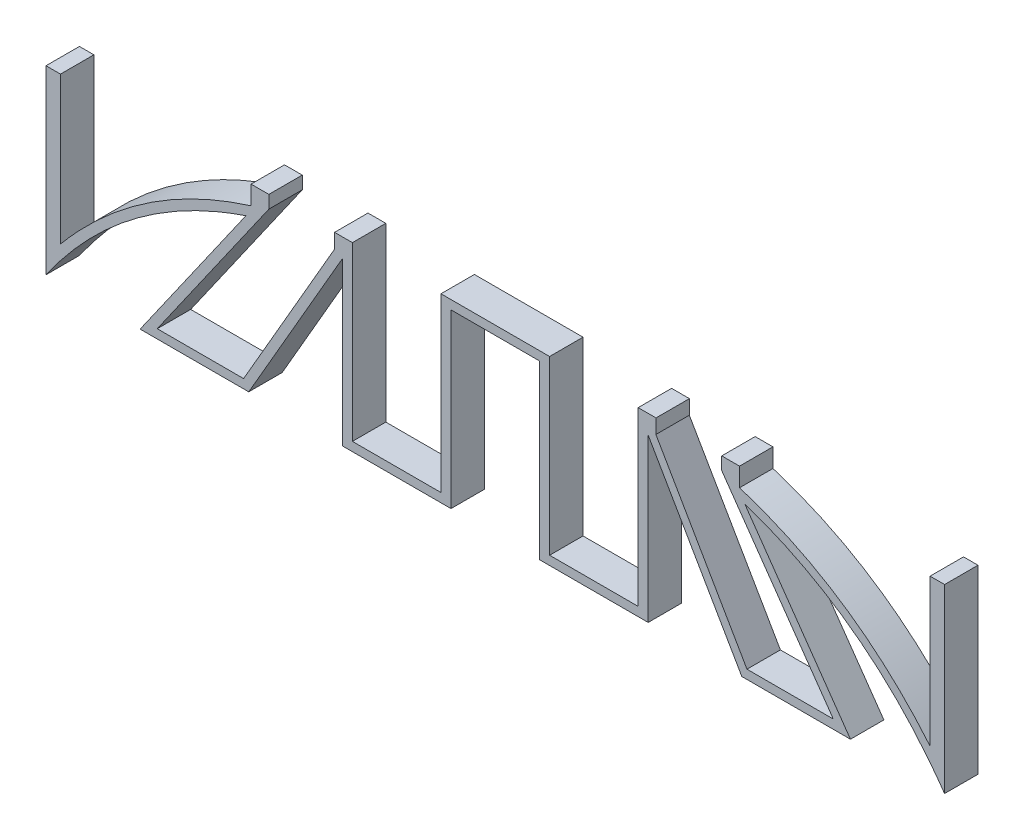
from build123d import *

# Parameters (mm, degrees)
BOSS_EXTRUDE1_DEPTH    = 3
SKETCH2_W              = 0.9
SKETCH2_H              = 15.45
BOSS_EXTRUDE2_DEPTH    = 3
SPLIT1_DEPTH           = 3
SPLIT1_START           = -36.35
SPLIT1_2_OUTLINE_W     = 16.25
SPLIT1_2_OUTLINE_H     = 3
SPLIT1_2_DEPTH         = 0.9
SPLIT1_START_2         = -35.45
SPLIT1_3_OUTLINE_W     = 0.8
SPLIT1_3_OUTLINE_H     = 3
SPLIT1_3_DEPTH         = 7.95
SPLIT1_4_DEPTH         = 3
BODY_MOVE_COPY13_ANGLE = 180
BODY_MOVE_COPY17_ANGLE = 180


# Read off the part's stored shape, not the designer's step: Split1
with BuildPart() as part:
    # Sketch1 → Boss-Extrude1 (new body)
    with BuildSketch(Plane(origin=(0, 0, 0), x_dir=(0, 1, 0), z_dir=(0, 0, 1))):
        with BuildLine():
            Line((0, 0), (-16.25, 0))
            add(Edge.make_bspline(
                [(-16.25, 0), (-9.683887405, 4.589558491), (-5.164437434, 10.570069252), (-2.691650088, 17.941532282)],
                knots=[0, 0, 0, 0, 0.866320649, 0.866320649, 0.866320649, 0.866320649], degree=3))
            Line((-2.691650088, 17.941532282), (-16.25, 8.447873633))
            Line((-16.25, 8.447873633), (-16.25, 18.197873462))
            Line((-16.25, 18.197873462), (-1.693141934, 26.602279385))
            Line((-1.693141934, 26.602279385), (-16.25, 26.602279385))
            Line((-16.25, 26.602279385), (-16.25, 45.197720615))
            Line((-16.25, 45.197720615), (-1.693141934, 45.197720615))
            Line((-1.693141934, 45.197720615), (-16.25, 53.602126538))
            Line((-16.25, 53.602126538), (-16.25, 63.352126367))
            Line((-16.25, 63.352126367), (-2.691650088, 53.858467718))
            add(Edge.make_bspline(
                [(-16.25, 71.8), (-9.683887405, 67.210441509), (-5.164437434, 61.229930748), (-2.691650088, 53.858467718)],
                knots=[0, 0, 0, 0, 0.866320649, 0.866320649, 0.866320649, 0.866320649], degree=3))
            Line((-16.25, 71.8), (0, 71.8))
            Line((0, 71.8), (0, 70.499844847))
            Line((0, 70.499844847), (-13.214812034, 70.499844847))
            add(Edge.make_bspline(
                [(-13.214812034, 70.499844847), (-7.643374044, 65.864497023), (-3.799959359, 60.162821742), (-1.68456798, 53.394819004)],
                knots=[0, 0, 0, 0, 0.803721546, 0.803721546, 0.803721546, 0.803721546], degree=3))
            Line((-1.68456798, 53.394819004), (0, 53.394819004))
            Line((0, 53.394819004), (0, 51.800000008))
            Line((0, 51.800000008), (-1.146610933, 51.800000008))
            Line((-1.146610933, 51.800000008), (-15.450000067, 61.815340728))
            Line((-15.450000067, 61.815340728), (-15.450000067, 54.064006792))
            Line((-15.450000067, 54.064006792), (-1.293141934, 45.890540938))
            Line((-1.293141934, 45.890540938), (0, 45.9))
            Line((0, 45.9), (0, 44.3))
            Line((0, 44.3), (-15.45, 44.3))
            Line((-15.45, 44.3), (-15.45, 27.5))
            Line((-15.45, 27.5), (0, 27.5))
            Line((0, 27.5), (0, 25.9))
            Line((0, 25.9), (-1.293141934, 25.909459062))
            Line((-1.293141934, 25.909459062), (-15.450000067, 17.735993208))
            Line((-15.450000067, 17.735993208), (-15.450000067, 9.984659272))
            Line((-15.450000067, 9.984659272), (-1.146610933, 19.999999992))
            Line((-1.146610933, 19.999999992), (0, 19.999999992))
            Line((0, 19.999999992), (0, 18.405180996))
            Line((0, 18.405180996), (-1.68456798, 18.405180996))
            add(Edge.make_bspline(
                [(-13.214812034, 1.300155153), (-7.643374044, 5.935502977), (-3.799959359, 11.637178258), (-1.68456798, 18.405180996)],
                knots=[0, 0, 0, 0, 0.803721546, 0.803721546, 0.803721546, 0.803721546], degree=3))
            Line((-13.214812034, 1.300155153), (0, 1.300155153))
            Line((0, 1.300155153), (0, 0))
        make_face()
    extrude(amount=BOSS_EXTRUDE1_DEPTH)

    # Sketch2 → Boss-Extrude2 (add)
    with BuildSketch(Plane.XY.offset(3)):
        with Locations((-35.9, -7.725)):
            Rectangle(SKETCH2_W, SKETCH2_H)
    extrude(amount=-BOSS_EXTRUDE2_DEPTH)

    # Split1 outline → Split1 (cut)
    with BuildSketch(Plane.XY):
        with BuildLine():
            Line((-53.394819004, 0), (-53.394819004, -1.68456798))
            add(Edge.make_bspline(
                [(-53.394819004, -1.68456798), (-60.162821742, -3.799959359), (-65.864497023, -7.643374044), (-70.499844847, -13.214812034)],
                knots=[0, 0, 0, 0, 0.803721546, 0.803721546, 0.803721546, 0.803721546], degree=3))
            Line((-70.499844847, -13.214812034), (-70.499844847, 0))
            Line((-70.499844847, 0), (-71.8, 0))
            Line((-71.8, 0), (-71.8, -16.25))
            add(Edge.make_bspline(
                [(-71.8, -16.25), (-67.210441509, -9.683887405), (-61.229930748, -5.164437434), (-53.858467718, -2.691650088)],
                knots=[0, 0, 0, 0, 0.866320649, 0.866320649, 0.866320649, 0.866320649], degree=3))
            Line((-53.858467718, -2.691650088), (-63.352126367, -16.25))
            Line((-63.352126367, -16.25), (-53.602126538, -16.25))
            Line((-53.602126538, -16.25), (-45.197720615, -1.693141934))
            Line((-45.197720615, -1.693141934), (-45.197720615, -16.25))
            Line((-45.197720615, -16.25), (-27.5, -16.25))
            Line((-27.5, -16.25), (-27.5, -15.45))
            Line((-27.5, -15.45), (-35.45, -15.45))
            Line((-35.45, -15.45), (-35.45, 0))
            Line((-35.45, 0), (-36.35, 0))
            Line((-36.35, 0), (-36.35, -15.45))
            Line((-36.35, -15.45), (-44.3, -15.45))
            Line((-44.3, -15.45), (-44.3, 0))
            Line((-44.3, 0), (-45.9, 0))
            Line((-45.9, 0), (-45.890540938, -1.293141934))
            Line((-45.890540938, -1.293141934), (-54.064006792, -15.450000067))
            Line((-54.064006792, -15.450000067), (-61.815340728, -15.450000067))
            Line((-61.815340728, -15.450000067), (-51.800000008, -1.146610933))
            Line((-51.800000008, -1.146610933), (-51.800000008, 0))
            Line((-51.800000008, 0), (-53.394819004, 0))
        make_face()
    extrude(amount=SPLIT1_DEPTH, mode=Mode.SUBTRACT)


with BuildPart() as body_2:
    # Split1 2 outline → Split1 2 (new body)
    with BuildSketch(Plane.YZ.offset(SPLIT1_START)):
        with Locations((-8.125, 1.5)):
            Rectangle(SPLIT1_2_OUTLINE_W, SPLIT1_2_OUTLINE_H)
    extrude(amount=SPLIT1_2_DEPTH)

    # Split1 3 outline → Split1 3 (add)
    with BuildSketch(Plane.YZ.offset(SPLIT1_START_2)):
        with Locations((-15.85, 1.5)):
            Rectangle(SPLIT1_3_OUTLINE_W, SPLIT1_3_OUTLINE_H)
    extrude(amount=SPLIT1_3_DEPTH)


with BuildPart() as body_3:
    # Split1 4 outline → Split1 4 (new body)
    with BuildSketch(Plane.XY):
        with BuildLine():
            Line((-36.35, -16.25), (-36.35, -15.45))
            Line((-36.35, -15.45), (-44.3, -15.45))
            Line((-44.3, -15.45), (-44.3, 0))
            Line((-44.3, 0), (-45.9, 0))
            Line((-45.9, 0), (-45.890540938, -1.293141934))
            Line((-45.890540938, -1.293141934), (-54.064006792, -15.450000067))
            Line((-54.064006792, -15.450000067), (-61.815340728, -15.450000067))
            Line((-61.815340728, -15.450000067), (-51.800000008, -1.146610933))
            Line((-51.800000008, -1.146610933), (-51.800000008, 0))
            Line((-51.800000008, 0), (-53.394819004, 0))
            Line((-53.394819004, 0), (-53.394819004, -1.68456798))
            add(Edge.make_bspline(
                [(-53.394819004, -1.68456798), (-60.162821742, -3.799959359), (-65.864497023, -7.643374044), (-70.499844847, -13.214812034)],
                knots=[0, 0, 0, 0, 0.803721546, 0.803721546, 0.803721546, 0.803721546], degree=3))
            Line((-70.499844847, -13.214812034), (-70.499844847, 0))
            Line((-70.499844847, 0), (-71.8, 0))
            Line((-71.8, 0), (-71.8, -16.25))
            add(Edge.make_bspline(
                [(-71.8, -16.25), (-67.210441509, -9.683887405), (-61.229930748, -5.164437434), (-53.858467718, -2.691650088)],
                knots=[0, 0, 0, 0, 0.866320649, 0.866320649, 0.866320649, 0.866320649], degree=3))
            Line((-53.858467718, -2.691650088), (-63.352126367, -16.25))
            Line((-63.352126367, -16.25), (-53.602126538, -16.25))
            Line((-53.602126538, -16.25), (-45.197720615, -1.693141934))
            Line((-45.197720615, -1.693141934), (-45.197720615, -16.25))
            Line((-45.197720615, -16.25), (-36.35, -16.25))
        make_face()
    extrude(amount=SPLIT1_4_DEPTH)


with BuildPart() as body_3_1:
    # Body-Move/Copy11: moved
    add(body_3.part.moved(Location((-8.85, 0, 0))))


with BuildPart() as body_2_1:
    # Body-Move/Copy12: moved
    add(body_2.part.moved(Location((-8.85, 0, 0))))


with BuildPart() as body_2_2:
    # Body-Move/Copy13: moved
    add(body_2_1.part.rotate(Axis((0, -8.125, 1.5), (1, 0, 0)), BODY_MOVE_COPY13_ANGLE))


with BuildPart() as body_4:
    # Body-Move/Copy14: copy of body 2
    add(body_2_2.part.moved(Location((8.85, 0, 0))))


with BuildPart() as body_4_1:
    # Body-Move/Copy17: moved
    add(body_4.part.rotate(Axis((0, -8.125, 1.5), (1, 0, 0)), BODY_MOVE_COPY17_ANGLE))


with BuildPart() as body_3_2:
    add(body_3_1.part)

    # Combine1: union body 4, body 2, part
    add(body_4_1.part)
    add(body_2_2.part)
    add(part.part)


solid = body_3_2.part
